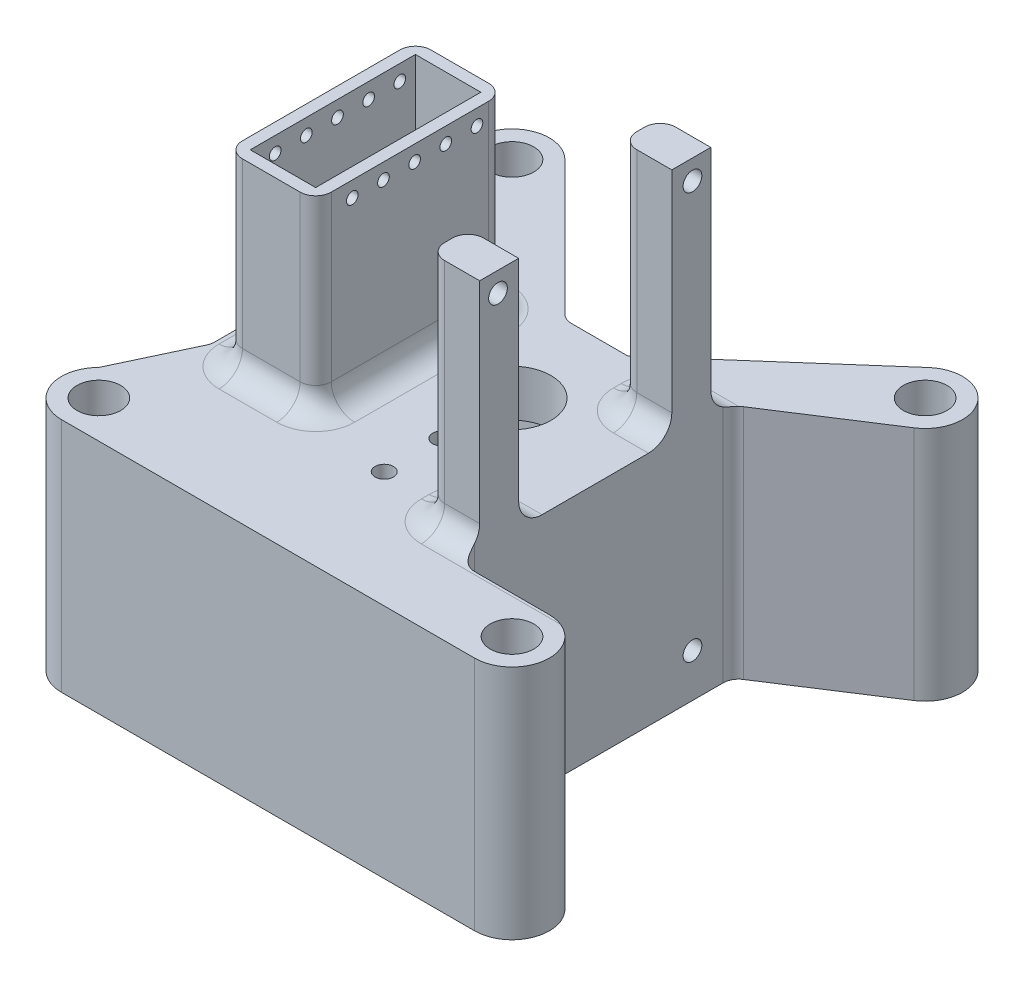
from build123d import *
from build123d.topology import SkipClean

# Parameters (mm, degrees)
SKETCH3_R           = 3.556
BOSS_EXTRUDE1_DEPTH = 21.463
SKETCH4_R           = 3.556
BOSS_EXTRUDE2_DEPTH = 7.366
SKETCH5_R           = 3.556
SKETCH5_R_2         = 6.35
BOSS_EXTRUDE3_DEPTH = 7.62
SKETCH6_W           = 14.478
SKETCH6_H           = 30.734
BOSS_EXTRUDE4_DEPTH = 30.59
SKETCH7_W           = 10.668
SKETCH7_H           = 26.924
CUT_EXTRUDE1_DEPTH  = 50.8
SKETCH8_R           = 0.9525
CUT_EXTRUDE2_DEPTH  = 104.085463514
SKETCH10_W          = 8.255
SKETCH10_H          = 6.35
BOSS_EXTRUDE5_DEPTH = 38.1
SKETCH9_R           = 1.524
CUT_EXTRUDE3_DEPTH  = 5.74999993
SKETCH13_R          = 1.5
CUT_EXTRUDE4_DEPTH  = 4.000000128
FILLET1_R           = 2.54
FILLET2_R           = 3.81
BOSS_EXTRUDE6_START = 2.058500074
SKETCH14_R          = 3.556
BOSS_EXTRUDE6_DEPTH = 2.058500074


with BuildPart() as part:
    # Sketch3 → Boss-Extrude1 (new body)
    with BuildSketch(Plane(origin=(0, 0, 0), x_dir=(1, 0, 0), z_dir=(0, 1, 0))):
        with BuildLine():
            Line((-33.675960454, -39.771960454), (33.675960454, -39.771960454))
            ThreePointArc((33.675960454, -39.771960454), (39.771960454, -33.675960454), (33.675960454, -27.579960454))
            Line((33.675960454, -27.579960454), (18.923, -27.579960454))
            Line((18.923, -27.579960454), (18.923, 16.870039546))
            Line((18.923, 16.870039546), (36.987426386, 28.557815343))
            ThreePointArc((36.987426386, 28.557815343), (38.539435093, 37.351260501), (29.656332864, 38.25895184))
            Line((29.656332864, 38.25895184), (3.556, 15.367))
            Line((3.556, 15.367), (3.556, 10.033))
            Line((3.556, 10.033), (10.033, 10.033))
            Line((10.033, 10.033), (10.033, -30.099))
            Line((10.033, -30.099), (-10.033, -30.099))
            Line((-10.033, -30.099), (-10.033, 10.033))
            Line((-10.033, 10.033), (-3.556, 10.033))
            Line((-3.556, 10.033), (-3.556, 15.367))
            Line((-3.556, 15.367), (-6.731, 15.367))
            Line((-6.731, 15.367), (-29.366862115, 37.987907521))
            ThreePointArc((-29.366862115, 37.987907521), (-36.009729137, 39.307544577), (-39.771960454, 33.675960454))
            ThreePointArc((-39.771960454, 33.675960454), (-39.691421033, 32.688311717), (-39.451930917, 31.726760309))
            Line((-39.451930917, 31.726760309), (-32.131, 10.033))
            Line((-32.131, 10.033), (-32.131, -16.891))
            Line((-32.131, -16.891), (-37.986483392, -29.365437516))
            ThreePointArc((-37.986483392, -29.365437516), (-39.307930084, -31.34312225), (-39.771960454, -33.675960454))
            ThreePointArc((-39.771960454, -33.675960454), (-37.986483392, -37.986483392), (-33.675960454, -39.771960454))
        make_face()
        with Locations((-33.675960454, 33.675960454)):
            Circle(SKETCH3_R, mode=Mode.SUBTRACT)
        with Locations((33.675960454, 33.675960454)):
            Circle(SKETCH3_R, mode=Mode.SUBTRACT)
        with Locations((33.675960454, -33.675960454)):
            Circle(SKETCH3_R, mode=Mode.SUBTRACT)
        with Locations((-33.675960454, -33.675960454)):
            Circle(SKETCH3_R, mode=Mode.SUBTRACT)
    extrude(amount=BOSS_EXTRUDE1_DEPTH)

    # Sketch4 → Boss-Extrude2 (add)
    with BuildSketch(Plane(origin=(0, 21.463, 0), x_dir=(1, 0, 0), z_dir=(0, 1, 0))):
        with BuildLine():
            Line((3.556, 15.367), (-3.556, 15.367))
            Line((-3.556, 15.367), (-6.731, 15.367))
            Line((-6.731, 15.367), (-29.366862115, 37.987907521))
            ThreePointArc((-29.366862115, 37.987907521), (-36.891301736, 38.855033386), (-39.451930917, 31.726760309))
            Line((-39.451930917, 31.726760309), (-32.131, 10.033))
            Line((-32.131, 10.033), (-32.131, -16.891))
            Line((-32.131, -16.891), (-37.986483392, -29.365437516))
            ThreePointArc((-37.986483392, -29.365437516), (-39.307930084, -36.008798658), (-33.675960454, -39.771960454))
            Line((-33.675960454, -39.771960454), (33.675960454, -39.771960454))
            ThreePointArc((33.675960454, -39.771960454), (39.771960454, -33.675960454), (33.675960454, -27.579960454))
            Line((33.675960454, -27.579960454), (18.923, -27.579960454))
            Line((18.923, -27.579960454), (18.923, 16.870039546))
            Line((18.923, 16.870039546), (36.987426386, 28.557815343))
            ThreePointArc((36.987426386, 28.557815343), (38.539435093, 37.351260501), (29.656332864, 38.25895184))
            Line((29.656332864, 38.25895184), (3.556, 15.367))
        make_face()
        with Locations((33.675960454, -33.675960454)):
            Circle(SKETCH4_R, mode=Mode.SUBTRACT)
        with Locations((33.675960454, 33.675960454)):
            Circle(SKETCH4_R, mode=Mode.SUBTRACT)
        with Locations((-33.675960454, 33.675960454)):
            Circle(SKETCH4_R, mode=Mode.SUBTRACT)
        with Locations((-33.675960454, -33.675960454)):
            Circle(SKETCH4_R, mode=Mode.SUBTRACT)
        Polygon((-3.556, 10.033), (3.556, 10.033), (10.033, 10.033), (10.033, -30.099), (-10.033, -30.099), (-10.033, 10.033), align=None, mode=Mode.SUBTRACT)
    extrude(amount=BOSS_EXTRUDE2_DEPTH)

    # Sketch5 → Boss-Extrude3 (add)
    with BuildSketch(Plane(origin=(0, 28.829, 0), x_dir=(1, 0, 0), z_dir=(0, 1, 0))):
        with BuildLine():
            Line((3.556, 15.367), (-6.731, 15.367))
            Line((-6.731, 15.367), (-29.366862115, 37.987907521))
            ThreePointArc((-29.366862115, 37.987907521), (-36.891301736, 38.855033386), (-39.451930917, 31.726760309))
            Line((-39.451930917, 31.726760309), (-32.131, 10.033))
            Line((-32.131, 10.033), (-32.131, -16.891))
            Line((-32.131, -16.891), (-37.986483392, -29.365437516))
            ThreePointArc((-37.986483392, -29.365437516), (-39.307930084, -36.008798658), (-33.675960454, -39.771960454))
            Line((-33.675960454, -39.771960454), (33.675960454, -39.771960454))
            ThreePointArc((33.675960454, -39.771960454), (39.771960454, -33.675960454), (33.675960454, -27.579960454))
            Line((33.675960454, -27.579960454), (18.923, -27.579960454))
            Line((18.923, -27.579960454), (18.923, 16.870039546))
            Line((18.923, 16.870039546), (36.987426386, 28.557815343))
            ThreePointArc((36.987426386, 28.557815343), (38.539435093, 37.351260501), (29.656332864, 38.25895184))
            Line((29.656332864, 38.25895184), (3.556, 15.367))
        make_face()
        with Locations((33.675960454, 33.675960454)):
            Circle(SKETCH5_R, mode=Mode.SUBTRACT)
        with Locations((-33.675960454, 33.675960454)):
            Circle(SKETCH5_R, mode=Mode.SUBTRACT)
        with Locations((-33.675960454, -33.675960454)):
            Circle(SKETCH5_R, mode=Mode.SUBTRACT)
        with Locations((33.675960454, -33.675960454)):
            Circle(SKETCH5_R, mode=Mode.SUBTRACT)
        Circle(SKETCH5_R_2, mode=Mode.SUBTRACT)
    extrude(amount=BOSS_EXTRUDE3_DEPTH)

    # Sketch6 → Boss-Extrude4 (add)
    with BuildSketch(Plane(origin=(0, 36.449, 0), x_dir=(1, 0, 0), z_dir=(0, 1, 0))):
        with Locations((-20.447, -3.429)):
            Rectangle(SKETCH6_W, SKETCH6_H)
    extrude(amount=BOSS_EXTRUDE4_DEPTH)

    # Sketch7 → Cut-Extrude1 (cut)
    with BuildSketch(Plane(origin=(0, 67.039, 0), x_dir=(1, 0, 0), z_dir=(0, 1, 0))):
        with Locations((-20.447, -3.429)):
            Rectangle(SKETCH7_W, SKETCH7_H)
    extrude(amount=-CUT_EXTRUDE1_DEPTH, mode=Mode.SUBTRACT)

    # Sketch8 → Cut-Extrude2 (cut, through all)
    with BuildSketch(Plane.ZY.offset(27.686)):
        with Locations((-7.493, 64.499)):
            Circle(SKETCH8_R)
        with Locations((-2.413, 64.499)):
            Circle(SKETCH8_R)
        with Locations((2.667, 64.499)):
            Circle(SKETCH8_R)
        with Locations((7.747, 64.499)):
            Circle(SKETCH8_R)
        with Locations((12.827, 64.499)):
            Circle(SKETCH8_R)
    extrude(amount=-CUT_EXTRUDE2_DEPTH, mode=Mode.SUBTRACT)

    # Sketch10 → Boss-Extrude5 (add)
    with BuildSketch(Plane(origin=(0, 36.449, 0), x_dir=(1, 0, 0), z_dir=(0, 1, 0))):
        with Locations((14.7955, -21.014960454)):
            Rectangle(SKETCH10_W, SKETCH10_H)
        with Locations((14.7955, 10.305039546)):
            Rectangle(SKETCH10_W, SKETCH10_H)
    extrude(amount=BOSS_EXTRUDE5_DEPTH)

    # Sketch9 → Cut-Extrude3 (cut)
    with BuildSketch(Plane(origin=(18.923, 0, 0), x_dir=(0, 0, -1), z_dir=(1, 0, 0))):
        with Locations((-21.204960454, 71.3)):
            Circle(SKETCH9_R)
        with Locations((10.495039546, 71.3)):
            Circle(SKETCH9_R)
        with Locations((10.495039546, 5)):
            Circle(SKETCH9_R)
        with Locations((-21.204960454, 5)):
            Circle(SKETCH9_R)
    extrude(amount=-CUT_EXTRUDE3_DEPTH, mode=Mode.SUBTRACT)

    # Sketch13 → Cut-Extrude4 (cut)
    with BuildSketch(Plane(origin=(0, 36.449, 0), x_dir=(1, 0, 0), z_dir=(0, 1, 0))):
        with Locations((0, -11.43)):
            Circle(SKETCH13_R)
        with Locations((0, -20.828)):
            Circle(SKETCH13_R)
    extrude(amount=-CUT_EXTRUDE4_DEPTH, mode=Mode.SUBTRACT)

    # Fillet1
    fillet1_edges = [part.edges().sort_by_distance(p)[0] for p in [
        (10.668, 55.499, 17.839960454),
        (10.668, 55.499, 24.189960454),
        (10.668, 55.499, -7.130039546),
        (10.668, 55.499, -13.480039546),
        (-27.686, 51.744, -11.938),
        (-13.208, 51.744, -11.938),
        (-13.208, 51.744, 18.796),
        (-27.686, 51.744, 18.796),
        (-32.131, 18.2245, 16.891),
        (-32.131, 18.2245, -10.033),
        (-6.731, 18.2245, -15.367),
        (18.923, 18.2245, -16.870039546),
        (18.923, 18.2245, 27.579960454),
    ]]
    fillet(fillet1_edges, radius=FILLET1_R)

    # Fillet2
    fillet2_edges = [part.edges().sort_by_distance(p)[0] for p in [
        (-13.951948776, 36.449, -11.194051224),
        (-13.208, 36.449, 3.429),
        (-13.951948776, 36.449, 18.052051224),
        (-20.447, 36.449, 18.796),
        (-26.942051224, 36.449, 18.052051224),
        (-27.686, 36.449, 3.429),
        (-26.942051224, 36.449, -11.194051224),
        (16.0655, 36.449, 24.189960454),
        (11.411948776, 36.449, 23.446011678),
        (10.668, 36.449, 21.014960454),
        (11.411948776, 36.449, 18.58390923),
        (16.0655, 36.449, -7.130039546),
        (11.411948776, 36.449, -7.873988322),
        (10.668, 36.449, -10.305039546),
        (11.411948776, 36.449, -12.73609077),
        (-20.447, 36.449, -11.938),
        (16.0655, 36.449, 17.839960454),
        (16.0655, 36.449, -13.480039546),
    ]]
    fillet(fillet2_edges, radius=FILLET2_R)

    # Sketch14 → Boss-Extrude6 (add)
    with SkipClean():  # the faces are left unmerged after this step: merging them gives an invalid solid
        with BuildSketch(Plane.XZ.offset(BOSS_EXTRUDE6_START)):
            with BuildLine():
                Line((-3.556, -10.033), (-10.033, -10.033))
                Line((-10.033, -10.033), (-10.033, 30.099))
                Line((-10.033, 30.099), (10.033, 30.099))
                Line((10.033, 30.099), (10.033, -10.033))
                Line((10.033, -10.033), (3.556, -10.033))
                Line((3.556, -10.033), (3.556, -15.367))
                Line((3.556, -15.367), (29.656332864, -38.25895184))
                ThreePointArc((29.656332864, -38.25895184), (38.539435093, -37.351260501), (36.987426386, -28.557815343))
                Line((36.987426386, -28.557815343), (20.083222528, -17.620709426))
                ThreePointArc((20.083222528, -17.620709426), (19.231830489, -16.702019883), (18.923, -15.488148963))
                Line((18.923, -15.488148963), (18.923, 25.039960454))
                ThreePointArc((18.923, 25.039960454), (19.666948776, 26.836011678), (21.463, 27.579960454))
                Line((21.463, 27.579960454), (33.675960454, 27.579960454))
                ThreePointArc((33.675960454, 27.579960454), (39.771960454, 33.675960454), (33.675960454, 39.771960454))
                Line((33.675960454, 39.771960454), (-33.675960454, 39.771960454))
                ThreePointArc((-33.675960454, 39.771960454), (-39.307930084, 36.008798658), (-37.986483392, 29.365437516))
                Line((-37.986483392, 29.365437516), (-32.371707745, 17.403800315))
                ThreePointArc((-32.371707745, 17.403800315), (-32.191907189, 16.877416157), (-32.131, 16.324515771))
                Line((-32.131, 16.324515771), (-32.131, -9.615969956))
                ThreePointArc((-32.131, -9.615969956), (-32.164558092, -10.027490263), (-32.26434564, -10.428136683))
                Line((-32.26434564, -10.428136683), (-39.451930917, -31.726760309))
                ThreePointArc((-39.451930917, -31.726760309), (-36.891301736, -38.855033386), (-29.366862115, -37.987907521))
                Line((-29.366862115, -37.987907521), (-7.474846818, -16.110355389))
                ThreePointArc((-7.474846818, -16.110355389), (-6.651017369, -15.560185424), (-5.679389177, -15.367))
                Line((-5.679389177, -15.367), (-3.556, -15.367))
                Line((-3.556, -15.367), (-3.556, -10.033))
            make_face()
            with Locations((-33.675960454, -33.675960454)):
                Circle(SKETCH14_R, mode=Mode.SUBTRACT)
            with Locations((-33.675960454, 33.675960454)):
                Circle(SKETCH14_R, mode=Mode.SUBTRACT)
            with Locations((33.675960454, 33.675960454)):
                Circle(SKETCH14_R, mode=Mode.SUBTRACT)
            with Locations((33.675960454, -33.675960454)):
                Circle(SKETCH14_R, mode=Mode.SUBTRACT)
        extrude(amount=-BOSS_EXTRUDE6_DEPTH)


solid = part.part
